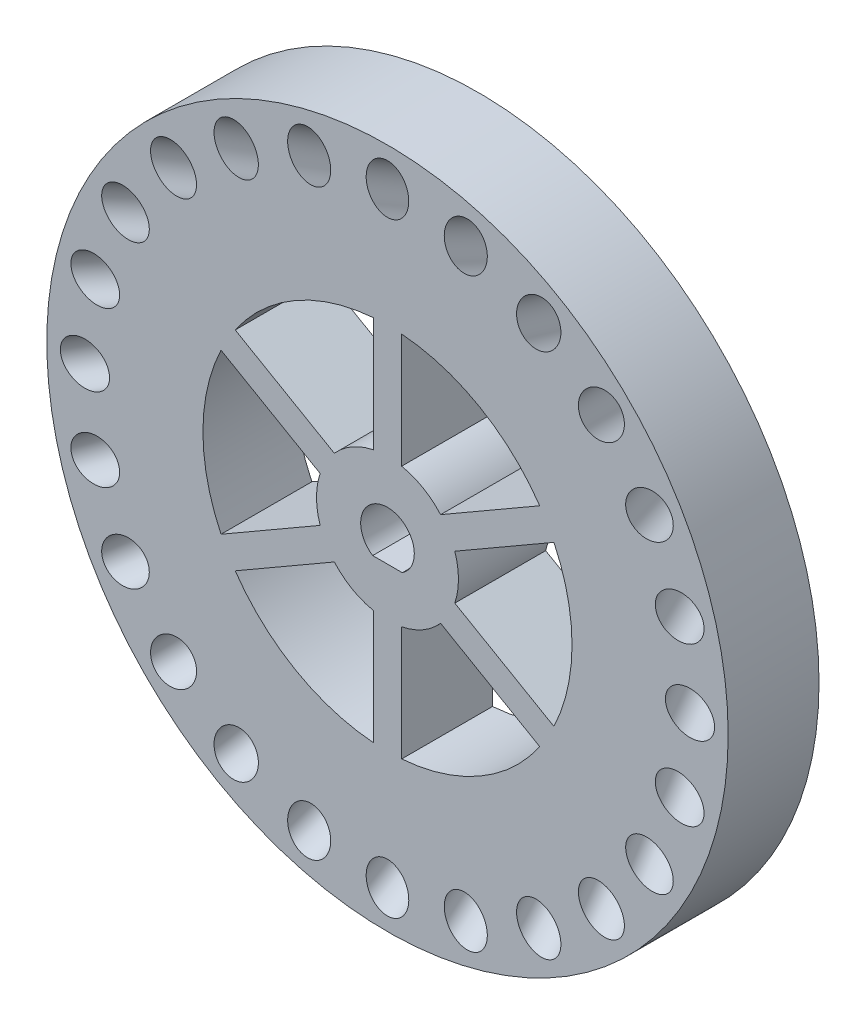
from build123d import *

# Parameters (mm, degrees)
SKETCH1_R           = 38.1
BOSS_EXTRUDE1_DEPTH = 10.16
SKETCH5_R           = 2.38125
CUT_EXTRUDE1_DEPTH  = 64.665985841
CIRPATTERN1_COUNT   = 24
CUT_EXTRUDE7_DEPTH  = 17.78


with BuildPart() as part:
    # Sketch1 → Boss-Extrude1 (new body)
    with BuildSketch(Plane.XY):
        Circle(SKETCH1_R)
        with BuildLine():
            Line((-1.658312395, -2.5), (1.658312395, -2.5))
            ThreePointArc((1.658312395, -2.5), (0, 3), (-1.658312395, -2.5))
        make_face(mode=Mode.SUBTRACT)
    extrude(amount=BOSS_EXTRUDE1_DEPTH)

    # Sketch5 → Cut-Extrude1 (cut, symmetric)
    with BuildSketch(Plane(origin=(0, 9.923909051, 17.188714686), x_dir=(0, 0.8660254037844364, -0.5000000000000041), z_dir=(0, -0.500000000000004, -0.8660254037844363))):
        with Locations((24.217429373, 0)):
            Circle(SKETCH5_R)
    cut_extrude1 = extrude(amount=CUT_EXTRUDE1_DEPTH, both=True, mode=Mode.SUBTRACT)

    # CirPattern1: Cut-Extrude1 ×24 about axis
    cirpattern1_axis = Axis((0, 0, 10.16), (0, 0, -1))
    for i in range(1, CIRPATTERN1_COUNT):
        add(cut_extrude1.rotate(cirpattern1_axis, i * 360 / CIRPATTERN1_COUNT), mode=Mode.SUBTRACT)

    # Sketch6 → Cut-Extrude7 (cut)
    with BuildSketch(Plane(origin=(0, 0, 0), x_dir=(-1, 0, 0), z_dir=(0, 0, -1))):
        with BuildLine():
            Line((-1.5875, 7.777129933), (-1.5875, 20.576351717))
            ThreePointArc((-1.5875, 20.576351717), (-10.31875, 17.872599271), (-17.025893305, 11.662991187))
            Line((-17.025893305, 11.662991187), (-5.941442091, 5.263380295))
            ThreePointArc((-5.941442091, 5.263380295), (-3.96875, 6.874076643), (-1.5875, 7.777129933))
        make_face()
        with BuildLine():
            Line((1.5875, 20.576351717), (1.5875, 7.777129933))
            ThreePointArc((1.5875, 7.777129933), (3.96875, 6.874076643), (5.941442091, 5.263380295))
            Line((5.941442091, 5.263380295), (17.025893305, 11.662991187))
            ThreePointArc((17.025893305, 11.662991187), (10.31875, 17.872599271), (1.5875, 20.576351717))
        make_face()
        with BuildLine():
            Line((18.613393305, 8.91336053), (7.528942091, 2.513749638))
            ThreePointArc((7.528942091, 2.513749638), (7.9375, 0), (7.528942091, -2.513749638))
            Line((7.528942091, -2.513749638), (18.613393305, -8.91336053))
            ThreePointArc((18.613393305, -8.91336053), (20.6375, 0), (18.613393305, 8.91336053))
        make_face()
        with BuildLine():
            Line((17.025893305, -11.662991187), (5.941442091, -5.263380295))
            ThreePointArc((5.941442091, -5.263380295), (3.96875, -6.874076643), (1.5875, -7.777129933))
            Line((1.5875, -7.777129933), (1.5875, -20.576351717))
            ThreePointArc((1.5875, -20.576351717), (10.31875, -17.872599271), (17.025893305, -11.662991187))
        make_face()
        with BuildLine():
            Line((-1.5875, -20.576351717), (-1.5875, -7.777129933))
            ThreePointArc((-1.5875, -7.777129933), (-3.96875, -6.874076643), (-5.941442091, -5.263380295))
            Line((-5.941442091, -5.263380295), (-17.025893305, -11.662991187))
            ThreePointArc((-17.025893305, -11.662991187), (-10.31875, -17.872599271), (-1.5875, -20.576351717))
        make_face()
        with BuildLine():
            Line((-18.613393305, -8.91336053), (-7.528942091, -2.513749638))
            ThreePointArc((-7.528942091, -2.513749638), (-7.9375, 0), (-7.528942091, 2.513749638))
            Line((-7.528942091, 2.513749638), (-18.613393305, 8.91336053))
            ThreePointArc((-18.613393305, 8.91336053), (-20.6375, 0), (-18.613393305, -8.91336053))
        make_face()
    extrude(amount=-CUT_EXTRUDE7_DEPTH, mode=Mode.SUBTRACT)


solid = part.part
